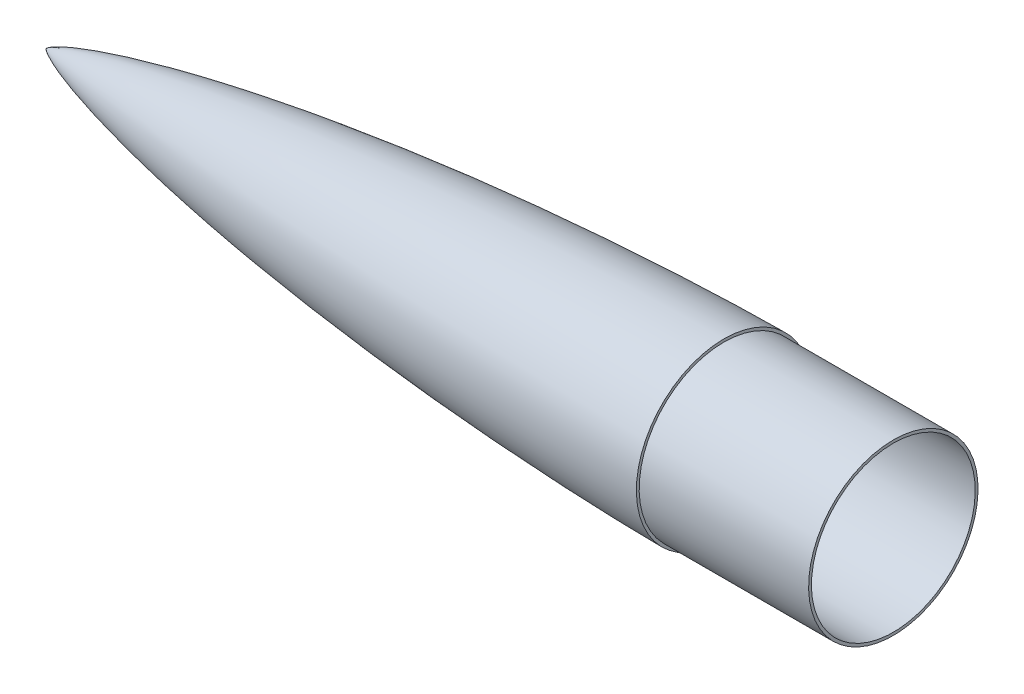
from build123d import *

# Parameters (mm, degrees)
ESQUISSE2_R        = 75
ESQUISSE2_R_2      = 72.5
BOSS_EXTRU_1_DEPTH = 150


with BuildPart() as part:
    # Esquisse1 → Révolution2 (revolve)
    with BuildSketch(Plane.XY):
        with BuildLine():
            Line((600, 77.47), (600, 0))
            Line((600, 0), (0, 0))
            add(Edge.make_bspline(
                [(0, 0), (0.001368209, 0.006717054), (0.004827879, 0.019916848), (0.014861135, 0.045329548), (0.040109462, 0.093838359), (0.080714574, 0.157043573), (0.138303004, 0.233353669), (0.220339344, 0.329970565), (0.319234099, 0.435072494), (0.434907239, 0.547862018), (0.567424397, 0.667916865), (0.77138124, 0.842123474), (1.105192587, 1.105167654), (1.695210245, 1.526031902), (2.747835687, 2.192934332), (4.58865834, 3.221966447), (7.854167938, 4.816978698), (13.522718171, 7.218567437), (23.083517428, 10.718170388), (38.736152508, 15.653589654), (62.100931146, 21.963904539), (92.158204371, 28.916284866), (127.237565622, 35.932970079), (164.730421006, 42.483131418), (202.346019248, 48.281341783), (240.055676064, 53.429010598), (277.839844478, 57.995158719), (315.684360025, 62.028879064), (353.578315333, 65.566601852), (391.513008679, 68.635634982), (429.481236678, 71.256357435), (467.476897077, 73.442933418), (500.742476414, 74.982720386), (529.266767626, 76.033942798), (552.966974815, 76.720644239), (569.49898194, 77.095642081), (583.616580802, 77.333227016), (592.97836336, 77.434381513), (597.659426856, 77.465844708), (600, 77.47)],
                knots=[0, 0, 0, 0, 0, 4.4888e-05, 8.9776e-05, 0.000179552, 0.000359104, 0.000538656, 0.000718209, 0.001013211, 0.001308213, 0.001601358, 0.001894502, 0.002777797, 0.004103551, 0.006367612, 0.010089263, 0.016646759, 0.028003564, 0.046855525, 0.077051893, 0.124598739, 0.187198888, 0.24979905, 0.31239921, 0.37499937, 0.437599529, 0.500199693, 0.562799853, 0.625400016, 0.688000177, 0.750600339, 0.813200502, 0.875800663, 0.907100744, 0.938400825, 0.969200412, 0.984600206, 1, 1, 1, 1, 1], degree=4))
        make_face()
    revolve(axis=Axis((2700, 0, 0), (-1, 0, 0)))

    # Esquisse2 → Boss.-Extru.1 (add)
    with BuildSketch(Plane(origin=(600, 0, 0), x_dir=(0, 0, -1), z_dir=(1, 0, 0))):
        Circle(ESQUISSE2_R)
        Circle(ESQUISSE2_R_2, mode=Mode.SUBTRACT)
    extrude(amount=BOSS_EXTRU_1_DEPTH)


solid = part.part
